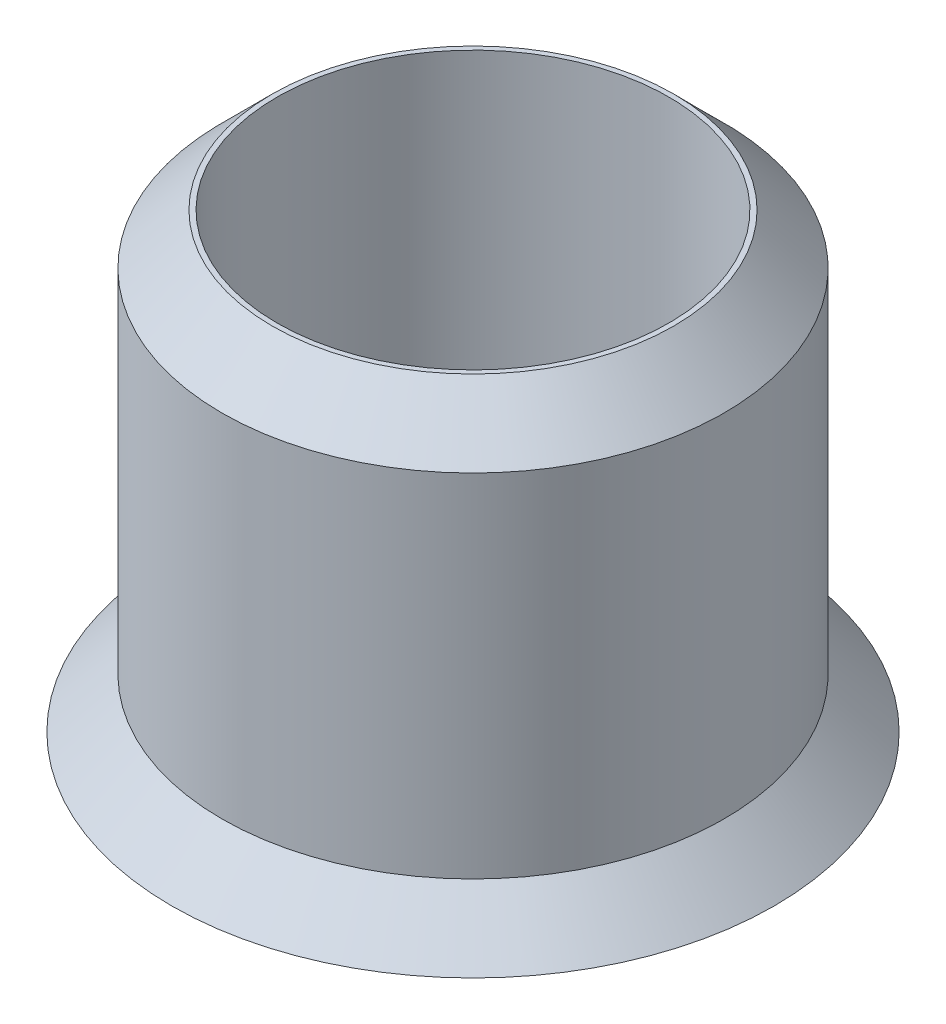
from build123d import *

# Parameters (mm, degrees)
SKETCH_1_R      = 6
EXTRUDE_1_DEPTH = 1
SKETCH_2_R      = 5
SKETCH_2_R_2    = 3.9
EXTRUDE_2_DEPTH = 8
CHAMFER_1_SIZE  = 1
CHAMFER_2_SIZE  = 1


with BuildPart() as part:
    # Эскиз1 → Бобышка-Вытянуть1 (new body)
    with BuildSketch(Plane(origin=(0, 0, 0), x_dir=(1, 0, 0), z_dir=(0, 1, 0))):
        with Locations(Location((0, 0, 0), (0, 0, 270))):
            Circle(SKETCH_1_R)
    extrude(amount=EXTRUDE_1_DEPTH)

    # Эскиз2 → Бобышка-Вытянуть2 (add)
    with BuildSketch(Plane(origin=(0, 1, 0), x_dir=(1, 0, 0), z_dir=(0, 1, 0))):
        with Locations(Location((0, 0, 0), (0, 0, 270))):
            Circle(SKETCH_2_R)
        with Locations(Location((0, 0, 0), (0, 0, 270))):
            Circle(SKETCH_2_R_2, mode=Mode.SUBTRACT)
    extrude(amount=EXTRUDE_2_DEPTH)

    # Фаска1
    chamfer_1_edges = [part.edges().sort_by_distance(p)[0] for p in [
        (0, 1, -6),
    ]]
    chamfer(chamfer_1_edges, length=CHAMFER_1_SIZE - 0.0001)  # a hair under: the kernel refuses the full size

    # Фаска2
    chamfer_2_edges = [part.edges().sort_by_distance(p)[0] for p in [
        (0, 9, -5),
    ]]
    chamfer(chamfer_2_edges, length=CHAMFER_2_SIZE)


solid = part.part
